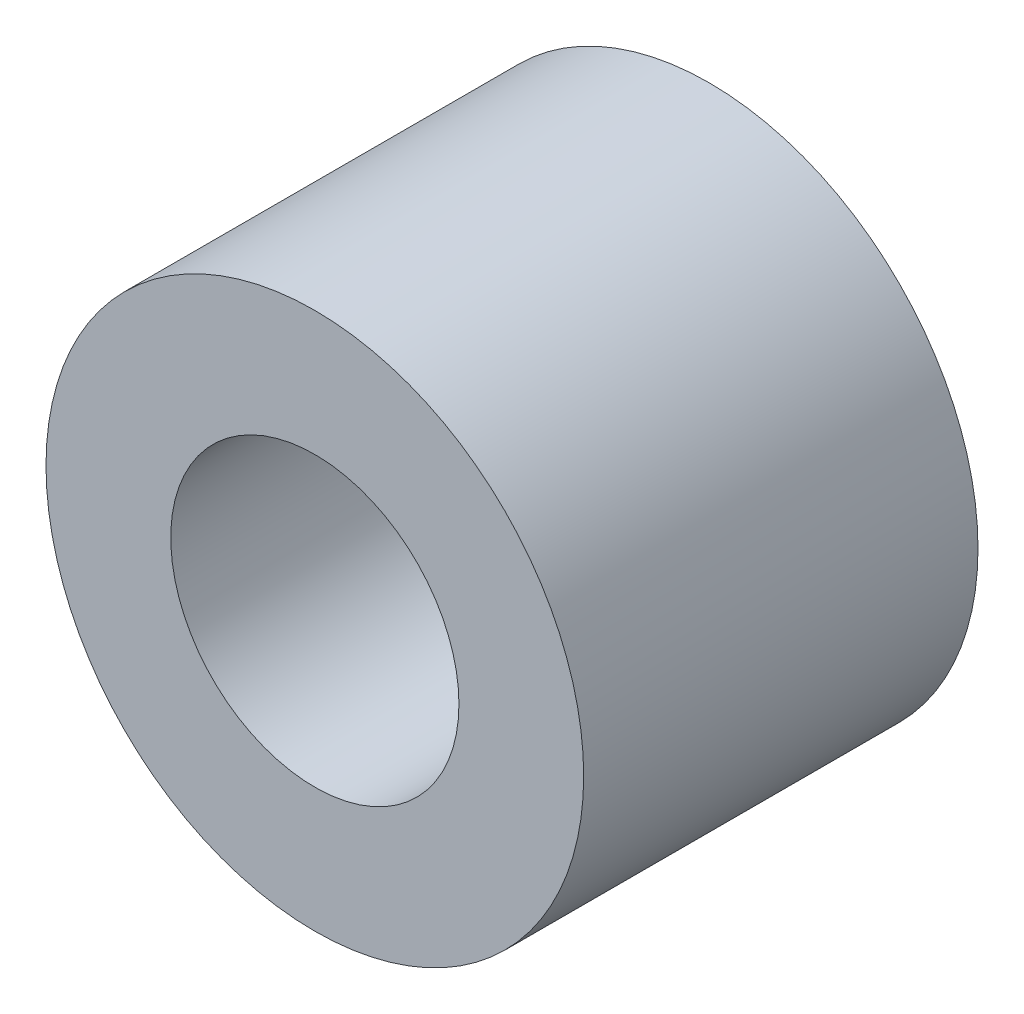
from build123d import *

# Parameters (mm, degrees)
SKETCH1_R           = 4.7625
SKETCH1_R_2         = 2.5527
BOSS_EXTRUDE1_DEPTH = 3.4925


with BuildPart() as part:
    # Sketch1 → Boss-Extrude1 (new, symmetric)
    with BuildSketch(Plane.XY):
        Circle(SKETCH1_R)
        Circle(SKETCH1_R_2, mode=Mode.SUBTRACT)
    extrude(amount=BOSS_EXTRUDE1_DEPTH, both=True)


solid = part.part
